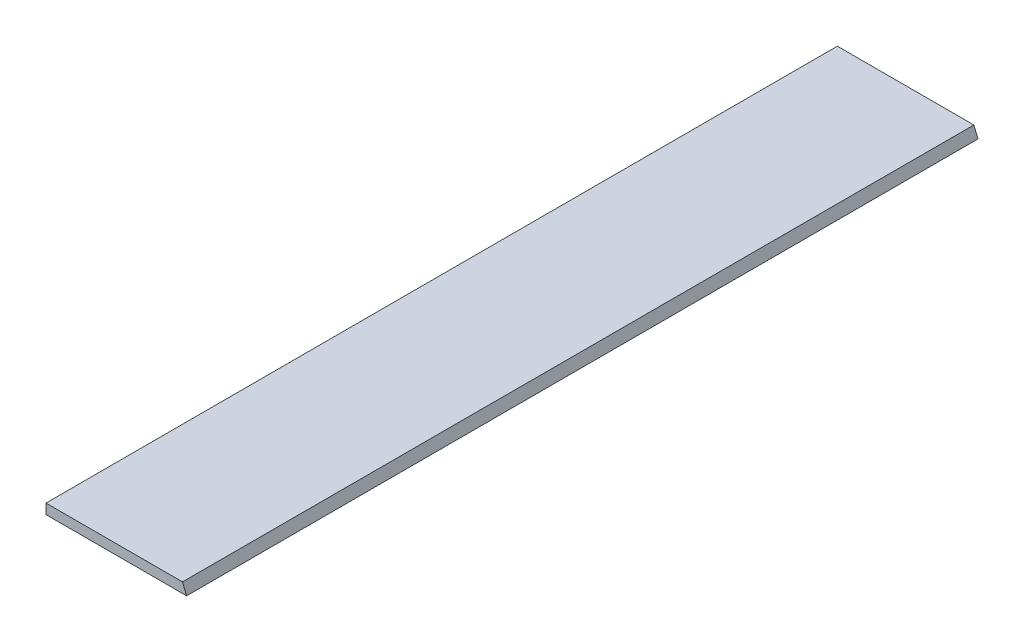
from build123d import *

# Parameters (mm, degrees)
BOSS_EXTRUDE1_DEPTH = 501.65


with BuildPart() as part:
    # Sketch1 → Boss-Extrude1 (new body)
    with BuildSketch(Plane.XY):
        Polygon((0, 0), (0, 6.35), (86.523743879, 6.35), (89.154, 0), align=None)
    extrude(amount=BOSS_EXTRUDE1_DEPTH)


solid = part.part
